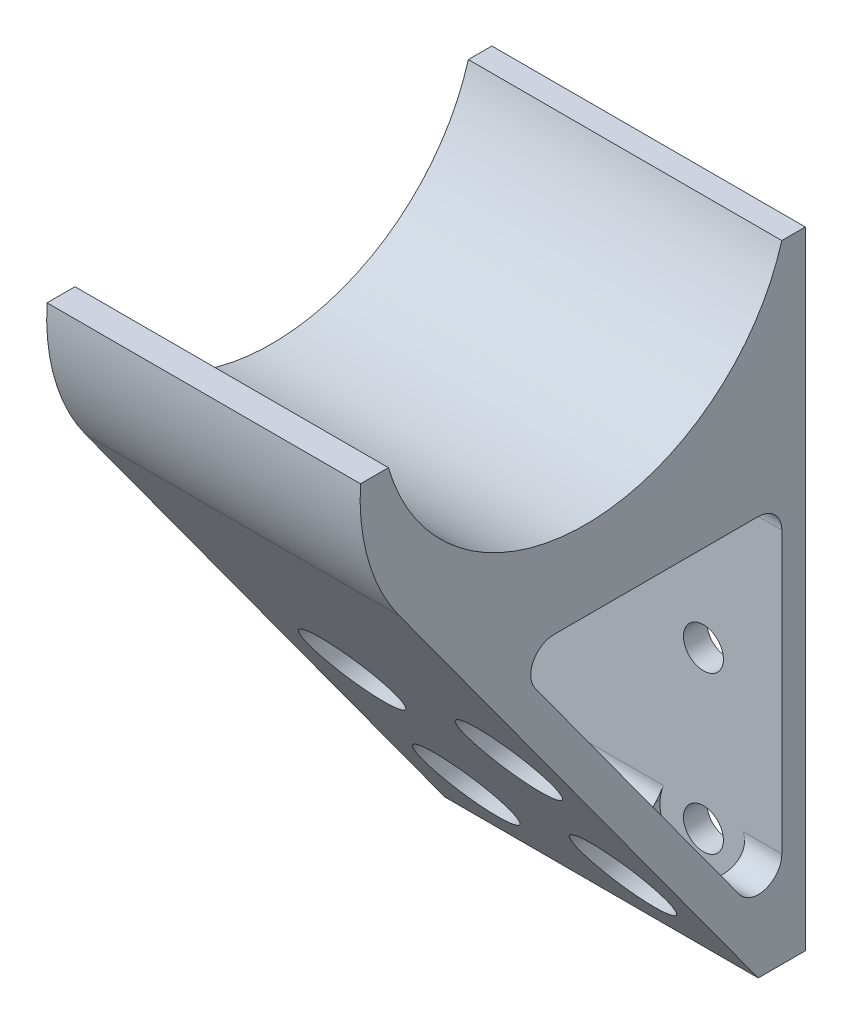
from build123d import *

# Parameters (mm, degrees)
EXTRUDE_1_DEPTH     = 40
SKETCH_2_R          = 2.55
CUT_EXTRUDE_1_DEPTH = 106.960776396
CUT_EXTRUDE_2_REACH = 106.383
SKETCH_3_R          = 5.55
SKETCH_3_R_2        = 2.55


with BuildPart() as part:
    # Эскиз1 → Бобышка-Вытянуть1 (new body)
    with BuildSketch(Plane(origin=(0, 0, 0), x_dir=(0, 0, -1), z_dir=(1, 0, 0))):
        with BuildLine():
            Line((0, 0), (0, -80))
            Line((0, -80), (-6, -80))
            Line((-6, -80), (-51.793990257, -17.080263038))
            ThreePointArc((-51.793990257, -17.080263038), (-55.770359862, -8.97429964), (-56.760361788, 0))
            Line((-56.760361788, 0), (-53.2, 0))
            ThreePointArc((-53.2, 0), (-28.1, -18.876088494), (-3, 0))
            Line((-3, 0), (0, 0))
        make_face()
        with BuildLine():
            Line((-3, -32), (-3, -67.780017305))
            ThreePointArc((-3, -67.780017305), (-5.071760776, -70.632800498), (-8.425581296, -69.545394143))
            Line((-8.425581296, -69.545394143), (-34.466849791, -33.765376837))
            ThreePointArc((-34.466849791, -33.765376837), (-34.714855086, -30.639141909), (-32.041268495, -29))
            Line((-32.041268495, -29), (-6, -29))
            ThreePointArc((-6, -29), (-3.878679656, -29.878679656), (-3, -32))
        make_face(mode=Mode.SUBTRACT)
    extrude(amount=EXTRUDE_1_DEPTH)

    # Эскиз2 → Вырез-Вытянуть1 (cut, through all)
    with BuildSketch(Plane(origin=(0, 0, 0), x_dir=(-1, 0, 0), z_dir=(0, 0, -1))):
        with Locations((-30, -50)):
            Circle(SKETCH_2_R)
        with Locations((-10, -50)):
            Circle(SKETCH_2_R)
        with Locations((-10, -70)):
            Circle(SKETCH_2_R)
        with Locations((-30, -70)):
            Circle(SKETCH_2_R)
    extrude(amount=-CUT_EXTRUDE_1_DEPTH, mode=Mode.SUBTRACT)

    # Вырез-Вытянуть2: up to this plane
    cut_extrude_2_end = Plane(origin=(40, -80, 6), z_dir=(0, 0.5884589457091373, -0.8085270986274306))
    # Эскиз3 → Вырез-Вытянуть2 (cut, up to the surface)
    with BuildSketch(Plane.XY.offset(3), mode=Mode.PRIVATE) as cut_extrude_2_sk1:
        with Locations((10, -50)):
            Circle(SKETCH_3_R)
        with Locations((10, -50)):
            Circle(SKETCH_3_R_2, mode=Mode.SUBTRACT)
    cut_extrude_2_tool1 = split(extrude(cut_extrude_2_sk1.sketch, amount=CUT_EXTRUDE_2_REACH, mode=Mode.PRIVATE), bisect_by=cut_extrude_2_end, keep=Keep.BOTH, mode=Mode.PRIVATE)
    add(cut_extrude_2_tool1.solids().sort_by_distance((4.606978, -50, 3))[0], mode=Mode.SUBTRACT)
    # Эскиз3 → Вырез-Вытянуть2 (cut, up to the surface)
    with BuildSketch(Plane.XY.offset(3), mode=Mode.PRIVATE) as cut_extrude_2_sk2:
        with Locations((30, -50)):
            Circle(SKETCH_3_R)
        with Locations((30, -50)):
            Circle(SKETCH_3_R_2, mode=Mode.SUBTRACT)
    cut_extrude_2_tool2 = split(extrude(cut_extrude_2_sk2.sketch, amount=CUT_EXTRUDE_2_REACH, mode=Mode.PRIVATE), bisect_by=cut_extrude_2_end, keep=Keep.BOTH, mode=Mode.PRIVATE)
    add(cut_extrude_2_tool2.solids().sort_by_distance((24.606978, -50, 3))[0], mode=Mode.SUBTRACT)
    # Эскиз3 → Вырез-Вытянуть2 (cut, up to the surface)
    with BuildSketch(Plane.XY.offset(3), mode=Mode.PRIVATE) as cut_extrude_2_sk3:
        with Locations((10, -70)):
            Circle(SKETCH_3_R)
        with Locations((10, -70)):
            Circle(SKETCH_3_R_2, mode=Mode.SUBTRACT)
    cut_extrude_2_tool3 = split(extrude(cut_extrude_2_sk3.sketch, amount=CUT_EXTRUDE_2_REACH, mode=Mode.PRIVATE), bisect_by=cut_extrude_2_end, keep=Keep.BOTH, mode=Mode.PRIVATE)
    add(cut_extrude_2_tool3.solids().sort_by_distance((4.606978, -70, 3))[0], mode=Mode.SUBTRACT)
    # Эскиз3 → Вырез-Вытянуть2 (cut, up to the surface)
    with BuildSketch(Plane.XY.offset(3), mode=Mode.PRIVATE) as cut_extrude_2_sk4:
        with Locations((30, -70)):
            Circle(SKETCH_3_R)
        with Locations((30, -70)):
            Circle(SKETCH_3_R_2, mode=Mode.SUBTRACT)
    cut_extrude_2_tool4 = split(extrude(cut_extrude_2_sk4.sketch, amount=CUT_EXTRUDE_2_REACH, mode=Mode.PRIVATE), bisect_by=cut_extrude_2_end, keep=Keep.BOTH, mode=Mode.PRIVATE)
    add(cut_extrude_2_tool4.solids().sort_by_distance((24.606978, -70, 3))[0], mode=Mode.SUBTRACT)


solid = part.part
